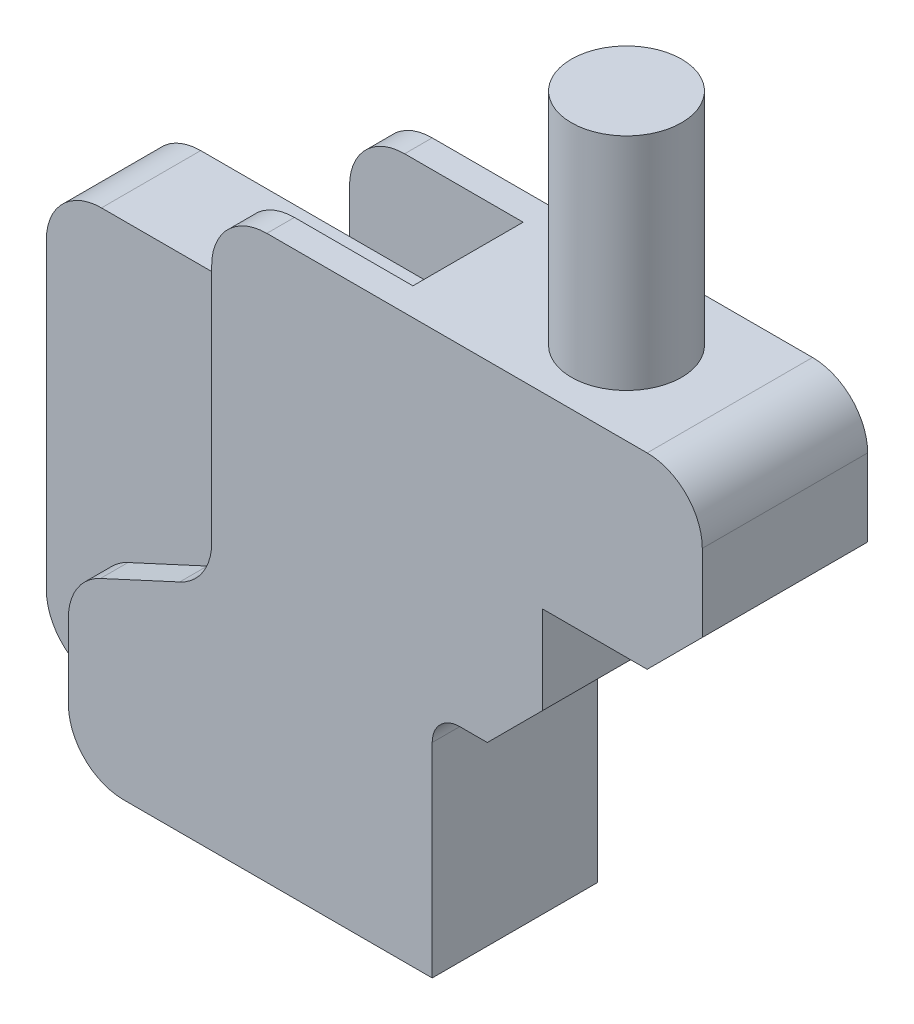
from build123d import *

# Parameters (mm, degrees)
BOSS_EXTRUDE1_DEPTH = 30
SKETCH2_W           = 61.936045122
SKETCH2_H           = 20
CUT_EXTRUDE1_DEPTH  = 92
SKETCH3_R           = 10
BOSS_EXTRUDE2_DEPTH = 40
SKETCH4_W           = 66.5
SKETCH4_H           = 18
BOSS_EXTRUDE3_DEPTH = 75
FILLET1_R           = 10
FILLET2_R           = 10


with BuildPart() as part:
    # Sketch1 → Boss-Extrude1 (new body)
    with BuildSketch(Plane.XY):
        with BuildLine():
            Line((-51.690581775, -18.31873005), (-37.309418225, -11.68126995))
            ThreePointArc((-37.309418225, -11.68126995), (-33.076645035, -7.99121144), (-31.5, -2.601676105))
            Line((-31.5, -2.601676105), (-31.5, 41))
            ThreePointArc((-31.5, 41), (-28.571067812, 48.071067812), (-21.5, 51))
            Line((-21.5, 51), (47.5, 51))
            ThreePointArc((47.5, 51), (54.571067812, 48.071067812), (57.5, 41))
            Line((57.5, 41), (57.5, 27))
            Line((57.5, 27), (47.5, 17))
            Line((47.5, 17), (28.5, 17))
            Line((28.5, 17), (28.5, 1))
            Line((28.5, 1), (18.5, -9))
            Line((18.5, -9), (13.5, -9))
            ThreePointArc((13.5, -9), (9.964466094, -10.464466094), (8.5, -14))
            Line((8.5, -14), (8.5, -51))
            Line((8.5, -51), (-47.5, -51))
            ThreePointArc((-47.5, -51), (-54.571067812, -48.071067812), (-57.5, -41))
            Line((-57.5, -41), (-57.5, -27.398323895))
            ThreePointArc((-57.5, -27.398323895), (-55.923354965, -22.00878856), (-51.690581775, -18.31873005))
        make_face()
    extrude(amount=BOSS_EXTRUDE1_DEPTH)

    # Sketch2 → Cut-Extrude1 (cut)
    with BuildSketch(Plane(origin=(0, 51, 0), x_dir=(1, 0, 0), z_dir=(0, 1, 0))):
        with Locations((-30.968022561, -15)):
            Rectangle(SKETCH2_W, SKETCH2_H)
    extrude(amount=-CUT_EXTRUDE1_DEPTH, mode=Mode.SUBTRACT)

    # Sketch3 → Boss-Extrude2 (add)
    with BuildSketch(Plane(origin=(0, 51, 0), x_dir=(1, 0, 0), z_dir=(0, 1, 0))):
        with Locations((28.75, -15)):
            Circle(SKETCH3_R)
    extrude(amount=BOSS_EXTRUDE2_DEPTH)

    # Sketch4 → Boss-Extrude3 (add)
    with BuildSketch(Plane(origin=(0, -41, 0), x_dir=(1, 0, 0), z_dir=(0, 1, 0))):
        with Locations((-34.25, -15)):
            Rectangle(SKETCH4_W, SKETCH4_H)
    extrude(amount=BOSS_EXTRUDE3_DEPTH)

    # Fillet1
    fillet1_edges = [part.edges().sort_by_distance(p)[0] for p in [
        (-67.5, -41, 15),
    ]]
    fillet(fillet1_edges, radius=FILLET1_R - 0.0001)  # a hair under: the kernel refuses the full size

    # Fillet2
    fillet2_edges = [part.edges().sort_by_distance(p)[0] for p in [
        (-67.5, 34, 15),
    ]]
    fillet(fillet2_edges, radius=FILLET2_R)


solid = part.part
